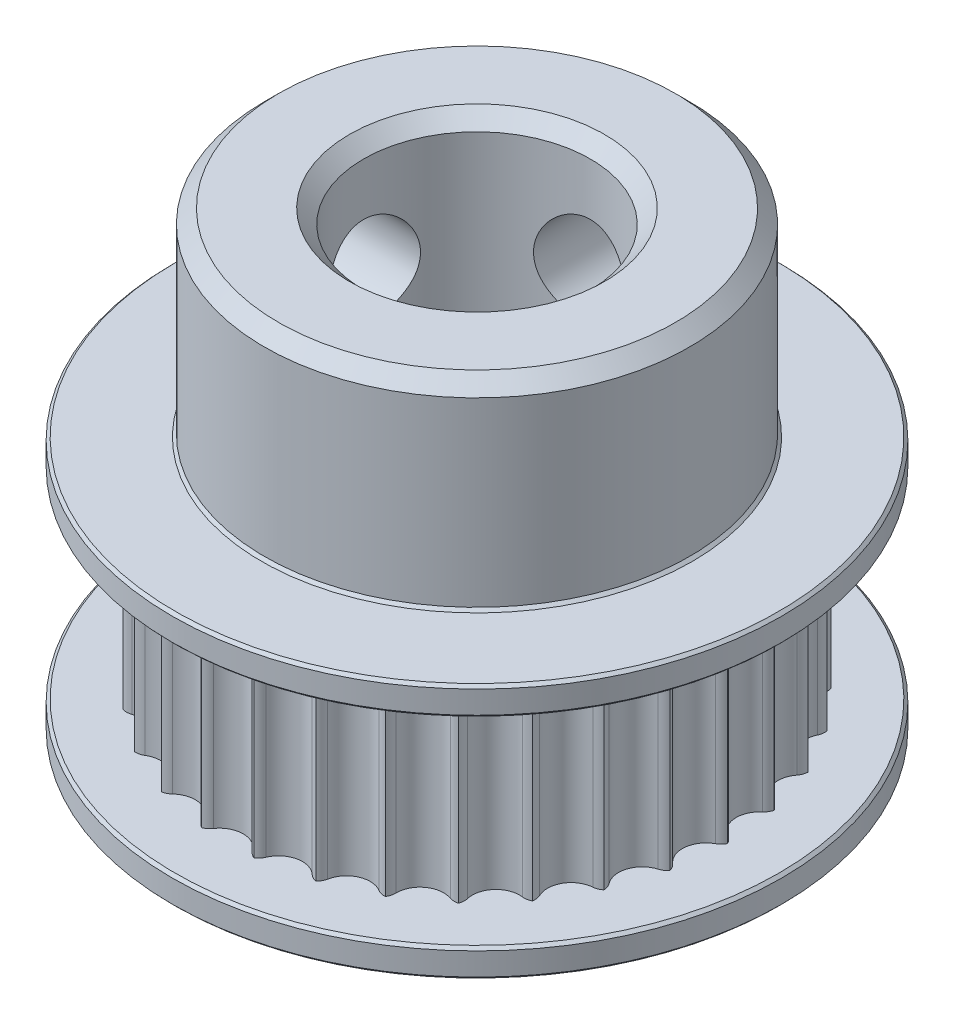
from build123d import *

# Parameters (mm, degrees)
CUT_EXTRUDE1_DEPTH      = 7
CIRPATTERN1_COUNT       = 30
CUT_EXTRUDE2_REACH      = 19.418
CUT_EXTRUDE2_END_RADIUS = 7.5
SKETCH3_R               = 1.65
CUT_EXTRUDE3_REACH      = 19.418
CUT_EXTRUDE3_END_RADIUS = 7.5
SKETCH4_R               = 1.65
CHAMFER1_SIZE           = 1
CHAMFER2_SIZE           = 0.5
CHAMFER3_SIZE           = 0.1


with BuildPart() as part:
    # Skica2 → Revolute (revolve)
    with BuildSketch(Plane.XY):
        Polygon((7.5, 8.5), (4, 8.5), (4, -8.5), (6.11, -8.5), (6.11, -7.5), (10.75, -7.5), (10.75, -6.5), (9.25, -6.5), (9.25, 0.5), (10.75, 0.5), (10.75, 1.5), (7.5, 1.5), align=None)
    revolve(axis=Axis((0, -8.5, 0), (0, 1, 0)))

    # Sketch2 → Cut-Extrude1 (cut)
    with BuildSketch(Plane.XZ.offset(-0.5)):
        with BuildLine():
            ThreePointArc((-0.688149825, 8.608192332), (0, 8.246880311), (0.688149825, 8.608192332))
            ThreePointArc((0.688149825, 8.608192332), (0.896854633, 8.78128412), (1.165221066, 8.819987111))
            ThreePointArc((1.165221066, 8.819987111), (1.389669154, 8.787418985), (1.61321413, 8.749140126))
            ThreePointArc((1.61321413, 8.749140126), (1.215542466, 9.923600007), (0, 10.168457672))
            ThreePointArc((0, 10.168457672), (-1.215542466, 9.923600007), (-1.61321413, 8.749140126))
            ThreePointArc((-1.61321413, 8.749140126), (-1.389669154, 8.787418985), (-1.165221066, 8.819987111))
            ThreePointArc((-1.165221066, 8.819987111), (-0.896854633, 8.78128412), (-0.688149825, 8.608192332))
        make_face()
    cut_extrude1 = extrude(amount=CUT_EXTRUDE1_DEPTH, mode=Mode.SUBTRACT)

    # CirPattern1: Cut-Extrude1 ×30 about axis
    cirpattern1_axis = Axis((0, 0, 0), (0, 1, 0))
    for i in range(1, CIRPATTERN1_COUNT):
        add(cut_extrude1.rotate(cirpattern1_axis, i * 360 / CIRPATTERN1_COUNT), mode=Mode.SUBTRACT)

    # Cut-Extrude2: up to this cylinder (the profile starts inside it)
    cut_extrude2_end = Plane(origin=(0, 4.5, 0), z_dir=(0, -1, 0)) * Cylinder(CUT_EXTRUDE2_END_RADIUS, 54.836, mode=Mode.PRIVATE)
    # Sketch3 → Cut-Extrude2 (cut, up to the surface)
    with BuildSketch(Plane(origin=(0, 0, 0), x_dir=(0, 0, -1), z_dir=(1, 0, 0)), mode=Mode.PRIVATE) as cut_extrude2_sk1:
        with Locations((0, 4.5)):
            Circle(SKETCH3_R)
    cut_extrude2_tool1 = extrude(cut_extrude2_sk1.sketch, amount=-CUT_EXTRUDE2_REACH, mode=Mode.PRIVATE) & cut_extrude2_end
    add(cut_extrude2_tool1.solids().sort_by_distance((0, 4.5, 0))[0], mode=Mode.SUBTRACT)

    # Cut-Extrude3: up to this cylinder (the profile starts inside it)
    cut_extrude3_end = Plane(origin=(0, 4.5, 0), z_dir=(0, -1, 0)) * Cylinder(CUT_EXTRUDE3_END_RADIUS, 54.836, mode=Mode.PRIVATE)
    # Sketch4 → Cut-Extrude3 (cut, up to the surface)
    with BuildSketch(Plane.XY, mode=Mode.PRIVATE) as cut_extrude3_sk1:
        with Locations((0, 4.5)):
            Circle(SKETCH4_R)
    cut_extrude3_tool1 = extrude(cut_extrude3_sk1.sketch, amount=-CUT_EXTRUDE3_REACH, mode=Mode.PRIVATE) & cut_extrude3_end
    add(cut_extrude3_tool1.solids().sort_by_distance((0, 4.5, 0))[0], mode=Mode.SUBTRACT)

    # Chamfer1
    chamfer1_edges = [part.edges().sort_by_distance(p)[0] for p in [
        (-6.11, -7.5, 0),
    ]]
    chamfer(chamfer1_edges, length=CHAMFER1_SIZE - 0.0001)  # a hair under: the kernel refuses the full size

    # Chamfer2
    chamfer2_edges = [part.edges().sort_by_distance(p)[0] for p in [
        (-4, 8.5, 0),
        (-7.5, 8.5, 0),
    ]]
    chamfer(chamfer2_edges, length=CHAMFER2_SIZE)

    # Chamfer3
    chamfer3_edges = [part.edges().sort_by_distance(p)[0] for p in [
        (-10.75, 0.5, 0),
        (-10.75, -6.5, 0),
        (-10.75, -7.5, 0),
        (-7.5, 1.5, 0),
        (-10.75, 1.5, 0),
    ]]
    chamfer(chamfer3_edges, length=CHAMFER3_SIZE)


solid = part.part
